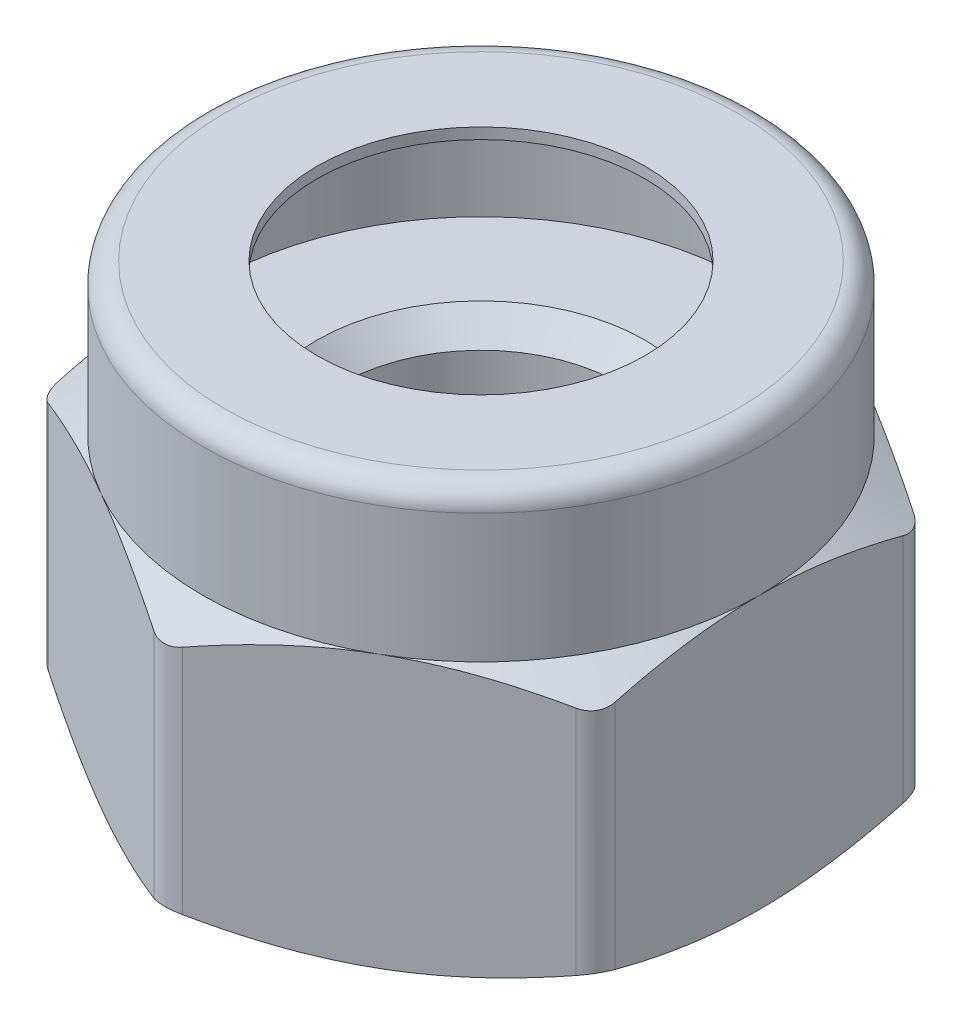
from build123d import *

# Parameters (mm, degrees)
BOSS_EXTRUDE1_START = 0.545843
BOSS_EXTRUDE1_DEPTH = 2.445843
FILLET1_R           = 0.257407407


with BuildPart() as part:
    # Sketch2 → Boss-Extrude1 (new body)
    with BuildSketch(Plane(origin=(0, 0, 0), x_dir=(1, 0, 0), z_dir=(0, 1, 0)).offset(BOSS_EXTRUDE1_START)):
        Polygon((2.5, 1.443375673), (0, 2.886751346), (-2.5, 1.443375673), (-2.5, -1.443375673), (0, -2.886751346), (2.5, -1.443375673), align=None)
    extrude(amount=-BOSS_EXTRUDE1_DEPTH)

    # Sketch3 → Cut-Revolve1 (revolve, cut)
    with BuildSketch(Plane.XY):
        Polygon((1.25, 1.267530544), (2.896111111, 0.317147851), (2.896111111, 1.267530544), align=None)
        Polygon((1.25, -2.621687836), (2.896111111, -1.671305143), (2.896111111, -2.621687836), align=None)
    revolve(axis=Axis((0, 1.9, 0), (0, -1, 0)), mode=Mode.SUBTRACT)

    # Fillet1
    fillet1_edges = [part.edges().sort_by_distance(p)[0] for p in [
        (-2.5, -0.677078646, -1.443375673),
        (-2.5, -0.677078646, 1.443375673),
        (0, -0.677078646, 2.886751346),
        (0, -0.677078646, -2.886751346),
        (2.5, -0.677078646, -1.443375673),
        (2.5, -0.677078646, 1.443375673),
    ]]
    fillet(fillet1_edges, radius=FILLET1_R)

    # Sketch5 → Cut-Revolve2 (revolve, cut)
    with BuildSketch(Plane.XY, mode=Mode.PRIVATE) as cut_revolve2_sk:
        Polygon((-1.475, -1.9), (-1.25, -1.675), (-1.25, 0.320842708), (-1.475, 0.545842708), (0, 0.545842708), (0, -1.9), align=None)
    revolve(cut_revolve2_sk.sketch.rotate(Axis((0, 1.9, 0), (0, -1, 0)), 270), axis=Axis((0, 1.9, 0), (0, -1, 0)), mode=Mode.SUBTRACT)


with BuildPart() as revolve1_tool:
    # Sketch4 → Revolve1 (revolve)
    with BuildSketch(Plane.XY):
        with BuildLine():
            Line((-1.475, 1.9), (-2.303125, 1.9))
            ThreePointArc((-2.303125, 1.9), (-2.442336648, 1.842336648), (-2.5, 1.703125))
            Line((-2.5, 1.703125), (-2.5, 0.545842708))
            Line((-2.5, 0.545842708), (-2.4015625, 0.545842708))
            Line((-2.4015625, 0.545842708), (-2.4015625, 1.703125))
            ThreePointArc((-2.4015625, 1.703125), (-2.372730824, 1.772730824), (-2.303125, 1.8015625))
            Line((-2.303125, 1.8015625), (-1.475, 1.8015625))
            Line((-1.475, 1.8015625), (-1.475, 1.9))
        make_face()
    revolve(axis=Axis((0, 1.9, 0), (0, -1, 0)))


with BuildPart() as part_1:
    add(part.part)


with BuildPart() as part_2:
    # Revolve1: joined with revolve1_tool
    add(part_1.part.fuse(revolve1_tool.part, tol=0.00001))


solid = part_2.part
